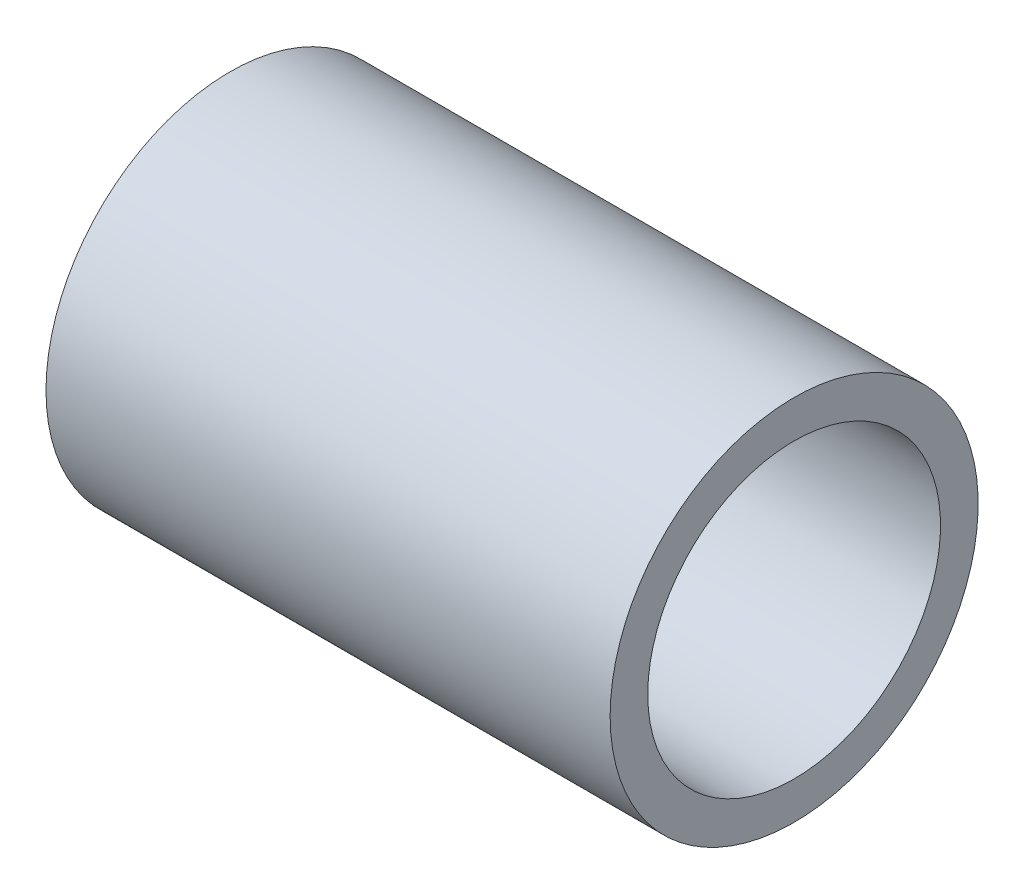
from build123d import *


with BuildPart() as part:
    # Sketch1 → Revolve1 (revolve)
    with BuildSketch(Plane.XY):
        Polygon((-1.1938, -7.8994), (1.1938, -7.8994), (1.1938, -10.6172), (20.7518, -10.7696), (20.7518, -13.5382), (-20.7518, -13.5382), (-20.7518, -10.7696), (-1.1938, -10.6172), align=None)
    revolve(axis=Axis((-20.7518, 0, 0), (1, 0, 0)))


solid = part.part
